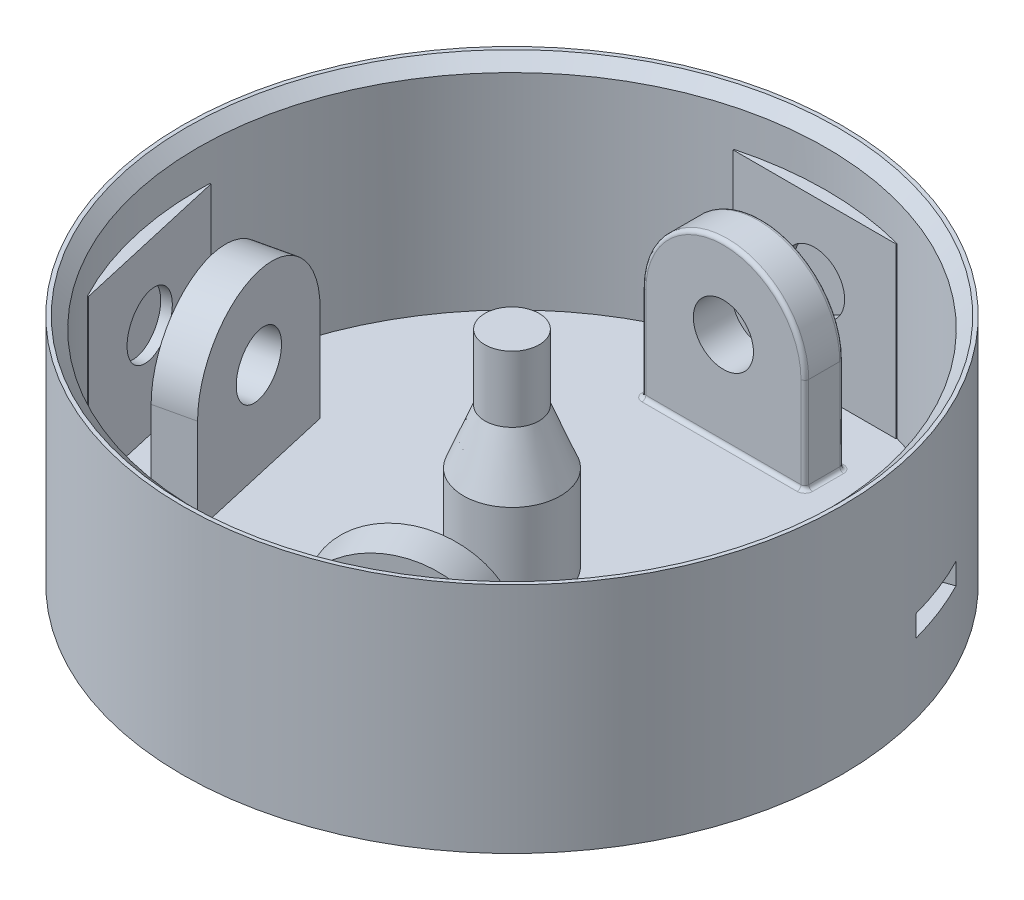
from build123d import *
from build123d.topology import SkipClean

# Parameters (mm, degrees)
SKETCH2_W               = 42
SKETCH2_H               = 10
BOSS_EXTRUDE1_DEPTH     = 45.5
FILLET1_RADIUS          = 21
FILLET1_LENGTH          = 10
SKETCH6_R               = 7.75
CUT_EXTRUDE2_DEPTH      = 26
FILLET2_R               = 1
CIRPATTERN4_START       = 54.5
CIRPATTERN4_OUTLINE_R   = 7.75
CIRPATTERN4_DEPTH       = 10
CIRPATTERN4_START_2     = 78
CIRPATTERN4_2_OUTLINE_W = 42
CIRPATTERN4_2_OUTLINE_H = 45.5
CIRPATTERN4_2_OUTLINE_R = 7.75
CIRPATTERN4_2_DEPTH     = 3
CIRPATTERN4_START_3     = 80.5
CIRPATTERN4_3_OUTLINE_R = 7.75
CIRPATTERN4_3_DEPTH     = 0.5
CIRPATTERN4_START_4     = -64.5
CIRPATTERN4_4_OUTLINE_R = 7.75
CIRPATTERN4_4_DEPTH     = 10
CIRPATTERN4_START_5     = -81.0000001
CIRPATTERN4_5_OUTLINE_W = 45.5
CIRPATTERN4_5_OUTLINE_H = 42
CIRPATTERN4_5_OUTLINE_R = 7.75
CIRPATTERN4_5_DEPTH     = 3.0000001
CIRPATTERN4_6_OUTLINE_R = 7.75
CIRPATTERN4_6_DEPTH     = 0.5000001
CUT_EXTRUDE3_START      = -2
CUT_EXTRUDE3_DEPTH      = 2
CIRPATTERN5_COUNT       = 7
SKETCH8_R               = 1.375
BOSS_EXTRUDE5_DEPTH     = 6
CUT_EXTRUDE4_DEPTH      = 1
SKETCH10_W              = 18
SKETCH10_H              = 5.5
CUT_EXTRUDE5_DEPTH      = 10


# Read off the part's stored shape, not the designer's step: CirPattern4
with BuildPart() as part:
    # Sketch1 → Revolve1 (revolve)
    with BuildSketch(Plane.XY, mode=Mode.PRIVATE) as revolve1_sk:
        Polygon((0, 0), (85, 0), (85, 60), (84, 60), (81, 57), (81, 4), (12.5, 4), (12.5, 26), (7, 40), (7, 57), (0, 57), align=None)
    revolve(revolve1_sk.sketch.rotate(Axis((0, 57, 0), (0, -1, 0)), 180), axis=Axis((0, 57, 0), (0, -1, 0)))

    # Sketch2 → Boss-Extrude1 (add)
    with BuildSketch(Plane(origin=(0, 4, 0), x_dir=(1, 0, 0), z_dir=(0, 1, 0))):
        with BuildLine():
            Line((-21, 78.230428862), (-21, 78))
            Line((-21, 78), (21, 78))
            Line((21, 78), (21, 78.230428862))
            ThreePointArc((21, 78.230428862), (0, 81), (-21, 78.230428862))
        make_face()
        with Locations((0, 59.5)):
            Rectangle(SKETCH2_W, SKETCH2_H)
    extrude(amount=BOSS_EXTRUDE1_DEPTH)

    # Fillet1: full round fillet: the end face becomes a half cylinder, R = half its width
    fillet1_face = Plane((0, 49.5, -59.5), x_dir=(0, 0, -1), z_dir=(0, 1, 0))  # on the end face: x along it, z out of the body
    fillet1_slab = fillet1_face.offset(-FILLET1_RADIUS / 2) * Box(FILLET1_LENGTH, 2 * FILLET1_RADIUS, FILLET1_RADIUS, mode=Mode.PRIVATE)  # the body's end, R deep
    fillet1_round = Plane((0, 28.5, -59.5), x_dir=(0, 1, 0), z_dir=(0, 0, -1)) * Cylinder(FILLET1_RADIUS, FILLET1_LENGTH, mode=Mode.PRIVATE)  # its axis R under the face
    add(fillet1_slab - fillet1_round, mode=Mode.SUBTRACT)

    # Sketch6 → Cut-Extrude2 (cut)
    with BuildSketch(Plane.XY.offset(-54.5)):
        with Locations((0, 28.5)):
            Circle(SKETCH6_R)
    extrude(amount=-CUT_EXTRUDE2_DEPTH, mode=Mode.SUBTRACT)

    # Fillet2
    fillet2_edges = [part.edges().sort_by_distance(p)[0] for p in [
        (-21, 4, -59.5),
        (0, 4, -54.5),
        (21, 4, -59.5),
        (0, 4, -64.5),
        (21, 16.25, -64.5),
        (21, 16.25, -54.5),
        (-21, 16.25, -54.5),
        (-21, 16.25, -64.5),
        (0, 49.5, -64.5),
        (0, 49.5, -54.5),
    ]]
    fillet(fillet2_edges, radius=FILLET2_R)

    # CirPattern4 outline → CirPattern4 (add)
    with BuildSketch(Plane(origin=(0, 0, 0), x_dir=(0.9009688679024158, 0, -0.433883739117565), z_dir=(0.43388373911756495, 0, 0.9009688679024159)).offset(CIRPATTERN4_START)):
        with BuildLine():
            Line((-21, 28.5), (-21, 4))
            Line((-21, 4), (22, 4))
            ThreePointArc((22, 4), (21.292893219, 4.292893219), (21, 5))
            Line((21, 5), (21, 28.5))
            ThreePointArc((21, 28.5), (0, 49.5), (-21, 28.5))
        make_face()
        with Locations((0, 28.5)):
            Circle(CIRPATTERN4_OUTLINE_R, mode=Mode.SUBTRACT)
    extrude(amount=CIRPATTERN4_DEPTH)

    # CirPattern4 2 outline → CirPattern4 2 (add)
    with BuildSketch(Plane(origin=(0, 0, 0), x_dir=(0.9009688679024158, 0, -0.433883739117565), z_dir=(0.43388373911756495, 0, 0.9009688679024159)).offset(CIRPATTERN4_START_2)):
        with Locations((0, 26.75)):
            Rectangle(CIRPATTERN4_2_OUTLINE_W, CIRPATTERN4_2_OUTLINE_H)
        with Locations((0, 28.5)):
            Circle(CIRPATTERN4_2_OUTLINE_R, mode=Mode.SUBTRACT)
    extrude(amount=CIRPATTERN4_2_DEPTH)

    # CirPattern4 3 outline → CirPattern4 3 (add)
    with BuildSketch(Plane(origin=(0, 0, 0), x_dir=(0.9009688679024158, 0, -0.433883739117565), z_dir=(0.43388373911756495, 0, 0.9009688679024159)).offset(CIRPATTERN4_START_3)):
        with Locations((0, 28.5)):
            Circle(CIRPATTERN4_3_OUTLINE_R)
    extrude(amount=CIRPATTERN4_3_DEPTH)

    # CirPattern4 4 outline → CirPattern4 4 (add)
    with BuildSketch(Plane(origin=(0, 0, 0), x_dir=(0, 1, 0), z_dir=(0.9749279121818228, 0, -0.22252093395631797)).offset(CIRPATTERN4_START_4)):
        with BuildLine():
            Line((4, -21), (28.5, -21))
            ThreePointArc((28.5, -21), (49.5, 0), (28.5, 21))
            Line((28.5, 21), (5, 21))
            ThreePointArc((5, 21), (4.292893219, 21.292893219), (4, 22))
            Line((4, 22), (4, -21))
        make_face()
        with Locations((28.5, 0)):
            Circle(CIRPATTERN4_4_OUTLINE_R, mode=Mode.SUBTRACT)
    extrude(amount=CIRPATTERN4_4_DEPTH)

    # CirPattern4 5 outline → CirPattern4 5 (add)
    with BuildSketch(Plane(origin=(0, 0, 0), x_dir=(0, 1, 0), z_dir=(0.9749279121818228, 0, -0.22252093395631797)).offset(CIRPATTERN4_START_5)):
        with Locations((26.75, 0)):
            Rectangle(CIRPATTERN4_5_OUTLINE_W, CIRPATTERN4_5_OUTLINE_H)
        with Locations((28.5, 0)):
            Circle(CIRPATTERN4_5_OUTLINE_R, mode=Mode.SUBTRACT)
    extrude(amount=CIRPATTERN4_5_DEPTH)

    # CirPattern4 6 outline → CirPattern4 6 (add)
    with BuildSketch(Plane(origin=(0, 0, 0), x_dir=(0, 1, 0), z_dir=(0.9749279121818228, 0, -0.22252093395631797)).offset(CIRPATTERN4_START_5)):
        with Locations((28.5, 0)):
            Circle(CIRPATTERN4_6_OUTLINE_R)
    extrude(amount=CIRPATTERN4_6_DEPTH)

    # Sketch7 → Cut-Extrude3 (cut)
    with SkipClean():  # the faces are left unmerged after this step: merging them gives an invalid solid
        with BuildSketch(Plane(origin=(0, 49.5, 0), x_dir=(1, 0, 0), z_dir=(0, 1, 0)).offset(CUT_EXTRUDE3_START)):
            with BuildLine():
                Line((-21, 78), (21, 78))
                Line((21, 78), (21, 78.230428862))
                ThreePointArc((21, 78.230428862), (0, 81), (-21, 78.230428862))
                Line((-21, 78.230428862), (-21, 78))
            make_face()
        cut_extrude3 = extrude(amount=CUT_EXTRUDE3_DEPTH, mode=Mode.SUBTRACT)

    # CirPattern5: Cut-Extrude3 ×7 about axis, 4 skipped
    with SkipClean():  # the faces are left unmerged after this step: merging them gives an invalid solid
        cirpattern5_axis = Axis((0, 0, 0), (0, 1, 0))
        add([cut_extrude3.rotate(cirpattern5_axis, i * 360 / CIRPATTERN5_COUNT) for i in range(1, CIRPATTERN5_COUNT) if i not in (1, 3, 5, 6)], mode=Mode.SUBTRACT)

    # Sketch8 → Boss-Extrude5 (add)
    # profile 1 of 2: a face of its own
    with SkipClean():  # the faces are left unmerged after this step: merging them gives an invalid solid
        with BuildSketch(Plane(origin=(0, 4, 0), x_dir=(1, 0, 0), z_dir=(0, 1, 0))):
            Polygon((62.160624934, -10.144190597), (33.5, -20.575804969), (36.57818129, -29.033038556), (65.238806224, -18.601424184), align=None)
            with Locations(Location((42.086785301, -22.239270687, 0), (0, 0, 270))):
                Circle(SKETCH8_R, mode=Mode.SUBTRACT)
            with Locations(Location((57.591713544, -16.595938322, 0), (0, 0, 270))):
                Circle(SKETCH8_R, mode=Mode.SUBTRACT)
        # profile 2 of 2: a face of its own
        with BuildSketch(Plane(origin=(0, 4, 0), x_dir=(1, 0, 0), z_dir=(0, 1, 0))):
            Polygon((63.100317555, -9.802170454), (71.557551142, -6.723989164), (64.717148275, 12.069863252), (56.259914688, 8.991681962), align=None)
            with Locations(Location((65.618833632, -3.564616705, 0), (0, 0, 270))):
                Circle(SKETCH8_R, mode=Mode.SUBTRACT)
            with Locations(Location((62.198632198, 5.832309503, 0), (0, 0, 270))):
                Circle(SKETCH8_R, mode=Mode.SUBTRACT)
        extrude(amount=BOSS_EXTRUDE5_DEPTH)

    # Sketch9 → Cut-Extrude4 (cut)
    with SkipClean():  # the faces are left unmerged after this step: merging them gives an invalid solid
        with BuildSketch(Plane(origin=(0, 4, 0), x_dir=(1, 0, 0), z_dir=(0, 1, 0))):
            Polygon((63.100317555, -9.802170454), (33.5, -20.575804969), (26.659597133, -1.781952553), (56.259914688, 8.991681962), align=None)
        extrude(amount=-CUT_EXTRUDE4_DEPTH, mode=Mode.SUBTRACT)

    # Sketch10 → Cut-Extrude5 (cut)
    with SkipClean():  # the faces are left unmerged after this step: merging them gives an invalid solid
        with BuildSketch(Plane(origin=(79.873872767, 0, -29.071712183), x_dir=(-0.3420201433256727, 0, -0.939692620785907), z_dir=(0.939692620785907, 0, -0.3420201433256727))):
            with Locations((1.707393103, 20.75)):
                Rectangle(SKETCH10_W, SKETCH10_H)
        extrude(amount=-CUT_EXTRUDE5_DEPTH, mode=Mode.SUBTRACT)


solid = part.part
